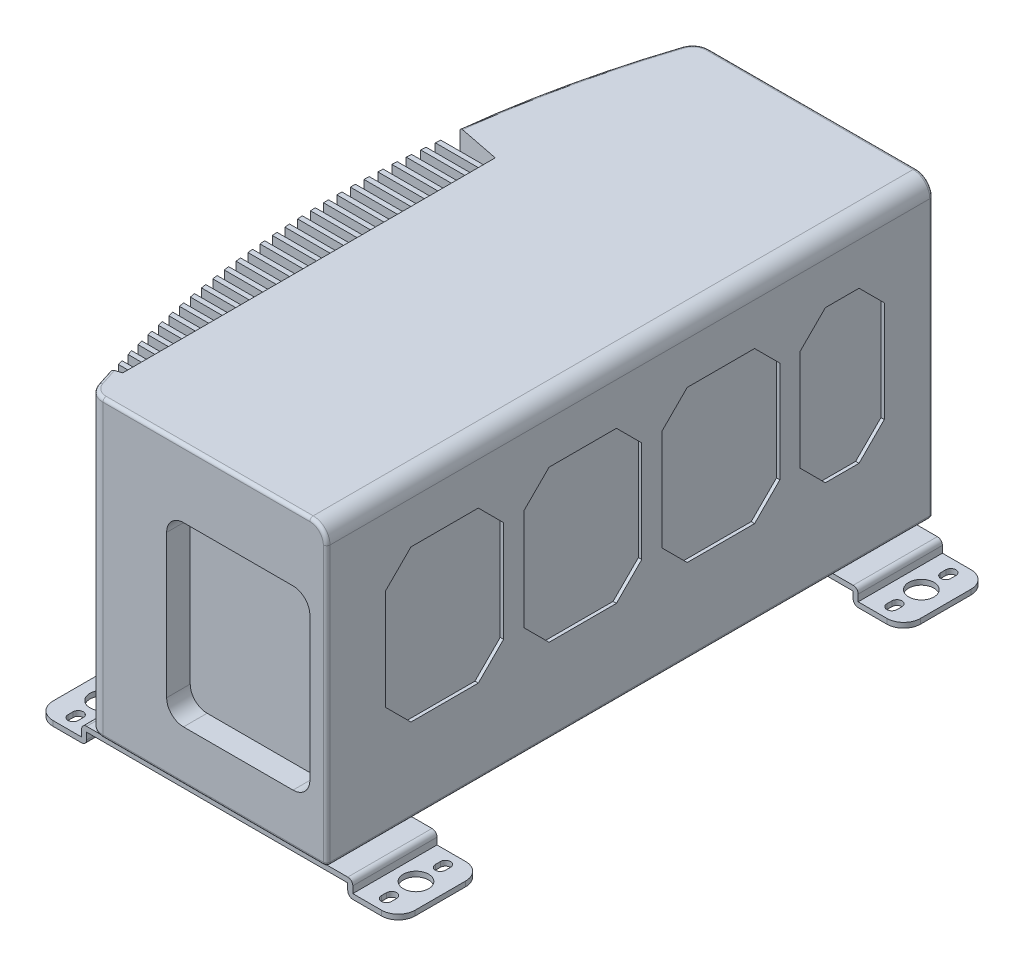
from build123d import *

# Parameters (mm, degrees)
EXTRUDE_1_DEPTH     = 175
CUT_EXTRUDE_1_DEPTH = 175
CUT_EXTRUDE_2_DEPTH = 2
SKETCH_4_W          = 85
SKETCH_4_H          = 105
CUT_EXTRUDE_3_DEPTH = 14
CUT_EXTRUDE_4_DEPTH = 2
CUT_EXTRUDE_5_DEPTH = 2
FILLET_1_R          = 10
FILLET_2_R          = 2
EXTRUDE_2_DEPTH     = 175
CUT_EXTRUDE_6_DEPTH = 125
FILLET_3_R          = 3
FILLET_4_R          = 3
FILLET_5_R          = 10
FILLET_6_R          = 10
EXTRUDE_3_REACH     = 277.326
SKETCH_10_R         = 10
CUT_EXTRUDE_7_REACH = 283.911
SKETCH_11_R         = 7.5


with BuildPart() as part:
    # 스케치1 → 보스-돌출1 (new body)
    with BuildSketch(Plane(origin=(0, 0, 0), x_dir=(1, 0, 0), z_dir=(0, 1, 0))):
        with BuildLine():
            Line((-70, 180), (70, 180))
            Line((70, 180), (70, -180))
            Line((70, -180), (-70, -180))
            ThreePointArc((-70, -180), (-100, 0), (-70, 180))
        make_face()
    extrude(amount=EXTRUDE_1_DEPTH)

    # 스케치2 → 컷-돌출1 (cut)
    with BuildSketch(Plane(origin=(0, 175, 0), x_dir=(1, 0, 0), z_dir=(0, 1, 0))):
        Polygon((-130.174377562, 60), (-70, 60), (-70, 55), (-130.174377562, 55), (-130.174377562, 52), (-70, 52), (-70, 47), (-130.174377562, 47), (-130.174377562, 44), (-70, 44), (-70, 39), (-130.174377562, 39), (-130.174377562, 36), (-70, 36), (-70, 31), (-130.174377562, 31), (-130.174377562, 28), (-70, 28), (-70, 23), (-130.174377562, 23), (-130.174377562, 20), (-70, 20), (-70, 15), (-130.174377562, 15), (-130.174377562, 12), (-70, 12), (-70, 7), (-130.174377562, 7), (-130.174377562, 4), (-70, 4), (-70, -1), (-130.174377562, -1), (-130.174377562, -4), (-70, -4), (-70, -9), (-130.174377562, -9), (-130.174377562, -12), (-70, -12), (-70, -17), (-130.174377562, -17), (-130.174377562, -20), (-70, -20), (-70, -25), (-130.174377562, -25), (-130.174377562, -28), (-70, -28), (-70, -33), (-130.174377562, -33), (-130.174377562, -36), (-70, -36), (-70, -41), (-130.174377562, -41), (-130.174377562, -44), (-70, -44), (-70, -49), (-130.174377562, -49), (-130.174377562, -52), (-70, -52), (-70, -57), (-130.174377562, -57), (-130.174377562, -60), (-70, -60), (-70, -65), (-130.174377562, -65), (-130.174377562, -68), (-70, -68), (-70, -73), (-130.174377562, -73), (-130.174377562, -76), (-70, -76), (-70, -81), (-130.174377562, -81), (-130.174377562, -84), (-70, -84), (-70, -89), (-130.174377562, -89), (-130.174377562, -92), (-70, -92), (-70, -97), (-130.174377562, -97), (-130.174377562, -100), (-70, -100), (-70, -105), (-130.174377562, -105), (-130.174377562, -108), (-70, -108), (-70, -113), (-130.174377562, -113), (-130.174377562, -116), (-70, -116), (-70, -121), (-130.174377562, -121), (-130.174377562, -124), (-70, -124), (-70, -129), (-130.174377562, -129), (-130.174377562, -132), (-70, -132), (-70, -137), (-130.174377562, -137), (-130.174377562, -140), (-70, -140), (-70, -145), (-130.174377562, -145), (-130.174377562, -148), (-70, -148), (-70, -153), (-130.174377562, -153), (-130.174377562, -156), (-70, -156), (-70, -161), (-130.174377562, -161), (-136.465426597, -161), (-136.465426597, 60), align=None)
    extrude(amount=-CUT_EXTRUDE_1_DEPTH, mode=Mode.SUBTRACT)

    # 모따기1
    # the kernel refuses this chamfer: 27, 5 mm, written as the material it takes off along each edge
    with BuildSketch(Plane(origin=(-96.747224732, 245.210319137, -60), x_dir=(0.11281304462547559, 0, -0.9936162322357311), z_dir=(0, -1, 0))) as chamfer_1_piece_1_section:
        with BuildLine():
            Line((5.343050655, -1.076373608), (2.960209633, 27.927681341))
            Line((2.960209633, 27.927681341), (2.423656867, 27.988600385))
            ThreePointArc((2.423656867, 27.988600385), (1.047531217, 14.012954144), (-0.536552765, 0.060919044))
            Line((-0.536552765, 0.060919044), (-0.002556302, -0.539993949))
            ThreePointArc((-0.002556302, -0.539993949), (2.671525967, -0.546216978), (5.345606957, -1.616367557))
            Line((5.345606957, -1.616367557), (5.343050655, -1.076373608))
        make_face()
    chamfer_1_piece_1 = extrude(amount=315.420638275, mode=Mode.PRIVATE)
    chamfer_1_piece_1 = split(chamfer_1_piece_1, bisect_by=Plane(origin=(-70, 245.210319137, -60), z_dir=(-1, 0, 0)), keep=Keep.TOP, mode=Mode.PRIVATE)
    add(chamfer_1_piece_1, mode=Mode.SUBTRACT)

    # 모따기2
    # the kernel refuses this chamfer: 6.2, 2 mm, written as the material it takes off along each edge
    with BuildSketch(Plane(origin=(-76.134634533, 191.096963911, 161), x_dir=(1, 0, 0), z_dir=(0, -1, 0))) as chamfer_2_piece_1_section:
        with BuildLine():
            Line((6.438278578, -0.08079908), (0.355766777, 2.015265936))
            Line((0.355766777, 2.015265936), (0.237230731, 2.051669312))
            ThreePointArc((0.237230731, 2.051669312), (0.176926574, 1.007924915), (-0.118667918, 0.035971171))
            Line((-0.118667918, 0.035971171), (0, -0.124))
            ThreePointArc((0, -0.124), (3.219139289, -0.124), (6.438278578, -0.20479908))
            Line((6.438278578, -0.20479908), (6.438278578, -0.08079908))
        make_face()
    chamfer_2_piece_1 = extrude(amount=207.193927822, mode=Mode.PRIVATE)
    chamfer_2_piece_1 = split(chamfer_2_piece_1, bisect_by=Plane(origin=(-70, 191.096963911, 161), z_dir=(-1, 0, 0)), keep=Keep.TOP, mode=Mode.PRIVATE)
    add(chamfer_2_piece_1, mode=Mode.SUBTRACT)

    # 스케치3 → 컷-돌출2 (cut)
    with BuildSketch(Plane(origin=(0, 175, 0), x_dir=(1, 0, 0), z_dir=(0, 1, 0))):
        Polygon((-96.154434973, 65.221076425), (-70, 60.054637785), (-70, -161.023838228), (-75.544399189, -162.934466855), (-119.874735378, -162.934466855), (-119.874735378, 65.221076425), align=None)
    extrude(amount=-CUT_EXTRUDE_2_DEPTH, mode=Mode.SUBTRACT)

    # 스케치4 → 컷-돌출3 (cut)
    with BuildSketch(Plane.XY.offset(180)):
        with Locations((17.5, 82.5)):
            Rectangle(SKETCH_4_W, SKETCH_4_H)
    extrude(amount=-CUT_EXTRUDE_3_DEPTH, mode=Mode.SUBTRACT)

    # 스케치5 → 컷-돌출4 (cut)
    with BuildSketch(Plane(origin=(70, 0, 0), x_dir=(0, 0, -1), z_dir=(1, 0, 0))):
        Polygon((-130, 140), (-90, 140), (-75, 125), (-75, 65), (-90, 50), (-130, 50), (-145, 65), (-145, 125), align=None)
        Polygon((-8, 140), (-48, 140), (-63, 125), (-63, 65), (-48, 50), (-8, 50), (7, 65), (7, 125), align=None)
        Polygon((74, 140), (34, 140), (19, 125), (19, 65), (34, 50), (74, 50), (89, 65), (89, 125), align=None)
        Polygon((136, 140), (116, 140), (101, 125), (101, 65), (116, 50), (136, 50), (151, 65), (151, 125), align=None)
    extrude(amount=-CUT_EXTRUDE_4_DEPTH, mode=Mode.SUBTRACT)

    # 스케치6 → 컷-돌출5 (cut)
    with BuildSketch(Plane(origin=(0, 0, -180), x_dir=(-1, 0, 0), z_dir=(0, 0, -1))):
        with BuildLine():
            Line((33, 45), (-38, 45))
            Line((-38, 45), (-45.464466094, 52.464466094))
            Line((-45.464466094, 52.464466094), (-19.880966757, 78.047965431))
            ThreePointArc((-19.880966757, 78.047965431), (-2.626045185, 72.500264791), (14.674884182, 77.902777528))
            Line((14.674884182, 77.902777528), (40.288830855, 52.288830855))
            Line((40.288830855, 52.288830855), (33, 45))
        make_face()
        with BuildLine():
            Line((55, 67), (55, 138))
            Line((55, 138), (47.535533906, 145.464466094))
            Line((47.535533906, 145.464466094), (21.952034569, 119.880966757))
            ThreePointArc((21.952034569, 119.880966757), (27.499735209, 102.626045185), (22.097222472, 85.325115818))
            Line((22.097222472, 85.325115818), (47.711169145, 59.711169145))
            Line((47.711169145, 59.711169145), (55, 67))
        make_face()
        with BuildLine():
            Line((33, 160), (-38, 160))
            Line((-38, 160), (-45.288830855, 152.711169145))
            Line((-45.288830855, 152.711169145), (-19.674884182, 127.097222472))
            ThreePointArc((-19.674884182, 127.097222472), (-2.373954815, 132.499735209), (14.880966757, 126.952034569))
            Line((14.880966757, 126.952034569), (40.464466094, 152.535533906))
            Line((40.464466094, 152.535533906), (33, 160))
        make_face()
        with BuildLine():
            Line((-60, 67), (-60, 138))
            Line((-60, 138), (-52.711169145, 145.288830855))
            Line((-52.711169145, 145.288830855), (-27.097222472, 119.674884182))
            ThreePointArc((-27.097222472, 119.674884182), (-32.499735209, 102.373954815), (-26.952034569, 85.119033243))
            Line((-26.952034569, 85.119033243), (-52.535533906, 59.535533906))
            Line((-52.535533906, 59.535533906), (-60, 67))
        make_face()
    extrude(amount=-CUT_EXTRUDE_5_DEPTH, mode=Mode.SUBTRACT)

    # 필렛1
    fillet_1_edges = [part.edges().sort_by_distance(p)[0] for p in [
        (70, 175, 0),
        (-70, 87.5, -180),
        (60, 135, 173),
        (60, 30, 173),
        (-25, 30, 173),
        (-25, 135, 173),
        (-70, 87.5, 180),
    ]]
    fillet(fillet_1_edges, radius=FILLET_1_R)

    # 필렛2
    fillet_2_edges = [part.edges().sort_by_distance(p)[0] for p in [
        (3.596060285, 0, 180),
        (70, 82.5, 180),
        (-1.403939715, 175, 180),
        (67.071067812, 172.071067812, 180),
        (-86.92372009, 0, -119.765110127),
        (3.596060285, 0, -180),
        (-68.673343583, 0, -178.099156146),
        (-68.673343583, 0, 178.099156146),
        (-1.403939715, 175, -180),
        (-86.92372009, 175, -119.765110127),
        (-68.673343583, 175, -178.099156146),
        (-68.673343583, 175, 178.099156146),
        (70, 82.5, -180),
        (67.071067812, 172.071067812, -180),
        (-73.951184045, 175, 168.034653859),
        (-73.951184045, 0, 168.034653859),
        (70, 0, 0),
    ]]
    fillet(fillet_2_edges, radius=FILLET_2_R)

    # 스케치10 → 보스-돌출3 (add, up to next)
    with BuildSketch(Plane(origin=(0, -3.460657517, 0), x_dir=(1, 0, 0), z_dir=(0, 1, 0)), mode=Mode.PRIVATE) as extrude_3_sk1:
        with Locations((-42.5, 150)):
            Circle(SKETCH_10_R)
    extrude_3_tool1 = extrude(extrude_3_sk1.sketch, amount=EXTRUDE_3_REACH, mode=Mode.PRIVATE) - part.part
    # 스케치10 → 보스-돌출3 (add, up to next)
    with BuildSketch(Plane(origin=(0, -3.460657517, 0), x_dir=(1, 0, 0), z_dir=(0, 1, 0)), mode=Mode.PRIVATE) as extrude_3_sk2:
        with Locations((42.5, 150)):
            Circle(SKETCH_10_R)
    extrude_3_tool2 = extrude(extrude_3_sk2.sketch, amount=EXTRUDE_3_REACH, mode=Mode.PRIVATE) - part.part
    # 스케치10 → 보스-돌출3 (add, up to next)
    with BuildSketch(Plane(origin=(0, -3.460657517, 0), x_dir=(1, 0, 0), z_dir=(0, 1, 0)), mode=Mode.PRIVATE) as extrude_3_sk3:
        with Locations((42.5, -150)):
            Circle(SKETCH_10_R)
    extrude_3_tool3 = extrude(extrude_3_sk3.sketch, amount=EXTRUDE_3_REACH, mode=Mode.PRIVATE) - part.part
    # 스케치10 → 보스-돌출3 (add, up to next)
    with BuildSketch(Plane(origin=(0, -3.460657517, 0), x_dir=(1, 0, 0), z_dir=(0, 1, 0)), mode=Mode.PRIVATE) as extrude_3_sk4:
        with Locations((-42.5, -150)):
            Circle(SKETCH_10_R)
    extrude_3_tool4 = extrude(extrude_3_sk4.sketch, amount=EXTRUDE_3_REACH, mode=Mode.PRIVATE) - part.part


with BuildPart() as body_2:
    # 스케치7 → 보스-돌출2 (new, symmetric)
    with BuildSketch(Plane.XY):
        Polygon((80.5, -3.460657517), (-80.5, -3.460657517), (-80.5, -10.460657517), (-107.5, -10.460657517), (-107.5, -13.460657517), (-77.5, -13.460657517), (-77.5, -6.460657517), (77.5, -6.460657517), (77.5, -13.460657517), (107.5, -13.460657517), (107.5, -10.460657517), (80.5, -10.460657517), align=None)
    extrude(amount=EXTRUDE_2_DEPTH, both=True)

    # 스케치9 → 컷-돌출6 (cut, symmetric)
    with BuildSketch(Plane.XY):
        Polygon((80.5, -10.460657517), (80.5, -3.460657517), (-80.5, -3.460657517), (-80.5, -10.460657517), (-107.5, -10.460657517), (-107.5, -13.460657517), (-77.5, -13.460657517), (-77.5, -6.460657517), (77.5, -6.460657517), (77.5, -13.460657517), (107.5, -13.460657517), (107.5, -10.460657517), align=None)
    extrude(amount=CUT_EXTRUDE_6_DEPTH, both=True, mode=Mode.SUBTRACT)


with BuildPart() as cut_extrude_6_piece_1:
    # of the separate pieces the step leaves, piece 1, a body of its own (cut_extrude_6_pieces)
    add(body_2.part.solids().sort_by_distance((80.5, -3.460657517, -125))[0])

    # 필렛4
    fillet_4_edges = [cut_extrude_6_piece_1.edges().sort_by_distance(p)[0] for p in [
        (80.5, -3.460657517, -150),
        (-80.5, -3.460657517, -150),
        (-77.5, -13.460657517, -150),
        (77.5, -13.460657517, -150),
    ]]
    fillet(fillet_4_edges, radius=FILLET_4_R)

    # 필렛6
    fillet_6_edges = [cut_extrude_6_piece_1.edges().sort_by_distance(p)[0] for p in [
        (-107.5, -11.960657517, -175),
        (107.5, -11.960657517, -175),
        (-107.5, -11.960657517, -125),
        (107.5, -11.960657517, -125),
    ]]
    fillet(fillet_6_edges, radius=FILLET_6_R)


with BuildPart() as cut_extrude_6_piece_2:
    # of the separate pieces the step leaves, piece 2, a body of its own (cut_extrude_6_pieces)
    add(body_2.part.solids().sort_by_distance((80.5, -3.460657517, 175))[0])

    # 필렛3
    fillet_3_edges = [cut_extrude_6_piece_2.edges().sort_by_distance(p)[0] for p in [
        (77.5, -13.460657517, 150),
        (-77.5, -13.460657517, 150),
        (-80.5, -3.460657517, 150),
        (80.5, -3.460657517, 150),
    ]]
    fillet(fillet_3_edges, radius=FILLET_3_R)

    # 필렛5
    fillet_5_edges = [cut_extrude_6_piece_2.edges().sort_by_distance(p)[0] for p in [
        (-107.5, -11.960657517, 175),
        (107.5, -11.960657517, 175),
        (-107.5, -11.960657517, 125),
        (107.5, -11.960657517, 125),
    ]]
    fillet(fillet_5_edges, radius=FILLET_5_R)


with BuildPart() as part_1:
    add(part.part)

    add(cut_extrude_6_piece_1.part)  # 보스-돌출3 merges 컷-돌출6 piece 1

    add(cut_extrude_6_piece_2.part)  # 보스-돌출3 merges 컷-돌출6 piece 2
    add(extrude_3_tool1.solids().sort_by_distance((-42.5, -3.460658, -150))[0])
    add(extrude_3_tool2.solids().sort_by_distance((42.5, -3.460658, -150))[0])
    add(extrude_3_tool3.solids().sort_by_distance((42.5, -3.460658, 150))[0])
    add(extrude_3_tool4.solids().sort_by_distance((-42.5, -3.460658, 150))[0])

    # 스케치11 → 컷-돌출7 (cut, up to next)
    with BuildSketch(Plane.XZ.offset(13.460657517), mode=Mode.PRIVATE) as cut_extrude_7_sk1:
        with Locations(Location((93, 150, 0), (0, 0, 270))):
            Circle(SKETCH_11_R)
    cut_extrude_7_tool1 = extrude(cut_extrude_7_sk1.sketch, amount=-CUT_EXTRUDE_7_REACH, mode=Mode.PRIVATE) & part_1.part
    # 스케치11 → 컷-돌출7 (cut, up to next)
    with BuildSketch(Plane.XZ.offset(13.460657517), mode=Mode.PRIVATE) as cut_extrude_7_sk2:
        with Locations(Location((-93, 150, 0), (0, 0, 270))):
            Circle(SKETCH_11_R)
    cut_extrude_7_tool2 = extrude(cut_extrude_7_sk2.sketch, amount=-CUT_EXTRUDE_7_REACH, mode=Mode.PRIVATE) & part_1.part
    # 스케치11 → 컷-돌출7 (cut, up to next)
    with BuildSketch(Plane.XZ.offset(13.460657517), mode=Mode.PRIVATE) as cut_extrude_7_sk3:
        with Locations(Location((93, -150, 0), (0, 0, 270))):
            Circle(SKETCH_11_R)
    cut_extrude_7_tool3 = extrude(cut_extrude_7_sk3.sketch, amount=-CUT_EXTRUDE_7_REACH, mode=Mode.PRIVATE) & part_1.part
    # 스케치11 → 컷-돌출7 (cut, up to next)
    with BuildSketch(Plane.XZ.offset(13.460657517), mode=Mode.PRIVATE) as cut_extrude_7_sk4:
        with Locations(Location((-93, -150, 0), (0, 0, 270))):
            Circle(SKETCH_11_R)
    cut_extrude_7_tool4 = extrude(cut_extrude_7_sk4.sketch, amount=-CUT_EXTRUDE_7_REACH, mode=Mode.PRIVATE) & part_1.part
    # 스케치11 → 컷-돌출7 (cut, up to next)
    with BuildSketch(Plane.XZ.offset(13.460657517), mode=Mode.PRIVATE) as cut_extrude_7_sk5:
        with BuildLine():
            Line((96, 167.5), (96, 164.5))
            ThreePointArc((96, 164.5), (93, 161.5), (90, 164.5))
            Line((90, 164.5), (90, 167.5))
            ThreePointArc((90, 167.5), (93, 170.5), (96, 167.5))
        make_face()
    cut_extrude_7_tool5 = extrude(cut_extrude_7_sk5.sketch, amount=-CUT_EXTRUDE_7_REACH, mode=Mode.PRIVATE) & part_1.part
    # 스케치11 → 컷-돌출7 (cut, up to next)
    with BuildSketch(Plane.XZ.offset(13.460657517), mode=Mode.PRIVATE) as cut_extrude_7_sk6:
        with BuildLine():
            Line((96, 132.5), (96, 135.5))
            ThreePointArc((96, 135.5), (93, 138.5), (90, 135.5))
            Line((90, 135.5), (90, 132.5))
            ThreePointArc((90, 132.5), (93, 129.5), (96, 132.5))
        make_face()
    cut_extrude_7_tool6 = extrude(cut_extrude_7_sk6.sketch, amount=-CUT_EXTRUDE_7_REACH, mode=Mode.PRIVATE) & part_1.part
    # 스케치11 → 컷-돌출7 (cut, up to next)
    with BuildSketch(Plane.XZ.offset(13.460657517), mode=Mode.PRIVATE) as cut_extrude_7_sk7:
        with BuildLine():
            Line((-96, 167.5), (-96, 164.5))
            ThreePointArc((-96, 164.5), (-93, 161.5), (-90, 164.5))
            Line((-90, 164.5), (-90, 167.5))
            ThreePointArc((-90, 167.5), (-93, 170.5), (-96, 167.5))
        make_face()
    cut_extrude_7_tool7 = extrude(cut_extrude_7_sk7.sketch, amount=-CUT_EXTRUDE_7_REACH, mode=Mode.PRIVATE) & part_1.part
    # 스케치11 → 컷-돌출7 (cut, up to next)
    with BuildSketch(Plane.XZ.offset(13.460657517), mode=Mode.PRIVATE) as cut_extrude_7_sk8:
        with BuildLine():
            Line((-96, 132.5), (-96, 135.5))
            ThreePointArc((-96, 135.5), (-93, 138.5), (-90, 135.5))
            Line((-90, 135.5), (-90, 132.5))
            ThreePointArc((-90, 132.5), (-93, 129.5), (-96, 132.5))
        make_face()
    cut_extrude_7_tool8 = extrude(cut_extrude_7_sk8.sketch, amount=-CUT_EXTRUDE_7_REACH, mode=Mode.PRIVATE) & part_1.part
    # 스케치11 → 컷-돌출7 (cut, up to next)
    with BuildSketch(Plane.XZ.offset(13.460657517), mode=Mode.PRIVATE) as cut_extrude_7_sk9:
        with BuildLine():
            Line((-96, -167.5), (-96, -164.5))
            ThreePointArc((-96, -164.5), (-93, -161.5), (-90, -164.5))
            Line((-90, -164.5), (-90, -167.5))
            ThreePointArc((-90, -167.5), (-93, -170.5), (-96, -167.5))
        make_face()
    cut_extrude_7_tool9 = extrude(cut_extrude_7_sk9.sketch, amount=-CUT_EXTRUDE_7_REACH, mode=Mode.PRIVATE) & part_1.part
    # 스케치11 → 컷-돌출7 (cut, up to next)
    with BuildSketch(Plane.XZ.offset(13.460657517), mode=Mode.PRIVATE) as cut_extrude_7_sk10:
        with BuildLine():
            Line((-96, -132.5), (-96, -135.5))
            ThreePointArc((-96, -135.5), (-93, -138.5), (-90, -135.5))
            Line((-90, -135.5), (-90, -132.5))
            ThreePointArc((-90, -132.5), (-93, -129.5), (-96, -132.5))
        make_face()
    cut_extrude_7_tool10 = extrude(cut_extrude_7_sk10.sketch, amount=-CUT_EXTRUDE_7_REACH, mode=Mode.PRIVATE) & part_1.part
    # 스케치11 → 컷-돌출7 (cut, up to next)
    with BuildSketch(Plane.XZ.offset(13.460657517), mode=Mode.PRIVATE) as cut_extrude_7_sk11:
        with BuildLine():
            Line((96, -167.5), (96, -164.5))
            ThreePointArc((96, -164.5), (93, -161.5), (90, -164.5))
            Line((90, -164.5), (90, -167.5))
            ThreePointArc((90, -167.5), (93, -170.5), (96, -167.5))
        make_face()
    cut_extrude_7_tool11 = extrude(cut_extrude_7_sk11.sketch, amount=-CUT_EXTRUDE_7_REACH, mode=Mode.PRIVATE) & part_1.part
    # 스케치11 → 컷-돌출7 (cut, up to next)
    with BuildSketch(Plane.XZ.offset(13.460657517), mode=Mode.PRIVATE) as cut_extrude_7_sk12:
        with BuildLine():
            Line((96, -132.5), (96, -135.5))
            ThreePointArc((96, -135.5), (93, -138.5), (90, -135.5))
            Line((90, -135.5), (90, -132.5))
            ThreePointArc((90, -132.5), (93, -129.5), (96, -132.5))
        make_face()
    cut_extrude_7_tool12 = extrude(cut_extrude_7_sk12.sketch, amount=-CUT_EXTRUDE_7_REACH, mode=Mode.PRIVATE) & part_1.part
    add(cut_extrude_7_tool1.solids().sort_by_distance((93, -13.460658, 150))[0], mode=Mode.SUBTRACT)
    add(cut_extrude_7_tool2.solids().sort_by_distance((-93, -13.460658, 150))[0], mode=Mode.SUBTRACT)
    add(cut_extrude_7_tool3.solids().sort_by_distance((93, -13.460658, -150))[0], mode=Mode.SUBTRACT)
    add(cut_extrude_7_tool4.solids().sort_by_distance((-93, -13.460658, -150))[0], mode=Mode.SUBTRACT)
    add(cut_extrude_7_tool5.solids().sort_by_distance((93, -13.460658, 166))[0], mode=Mode.SUBTRACT)
    add(cut_extrude_7_tool6.solids().sort_by_distance((93, -13.460658, 134))[0], mode=Mode.SUBTRACT)
    add(cut_extrude_7_tool7.solids().sort_by_distance((-93, -13.460658, 166))[0], mode=Mode.SUBTRACT)
    add(cut_extrude_7_tool8.solids().sort_by_distance((-93, -13.460658, 134))[0], mode=Mode.SUBTRACT)
    add(cut_extrude_7_tool9.solids().sort_by_distance((-93, -13.460658, -166))[0], mode=Mode.SUBTRACT)
    add(cut_extrude_7_tool10.solids().sort_by_distance((-93, -13.460658, -134))[0], mode=Mode.SUBTRACT)
    add(cut_extrude_7_tool11.solids().sort_by_distance((93, -13.460658, -166))[0], mode=Mode.SUBTRACT)
    add(cut_extrude_7_tool12.solids().sort_by_distance((93, -13.460658, -134))[0], mode=Mode.SUBTRACT)


solid = part_1.part
